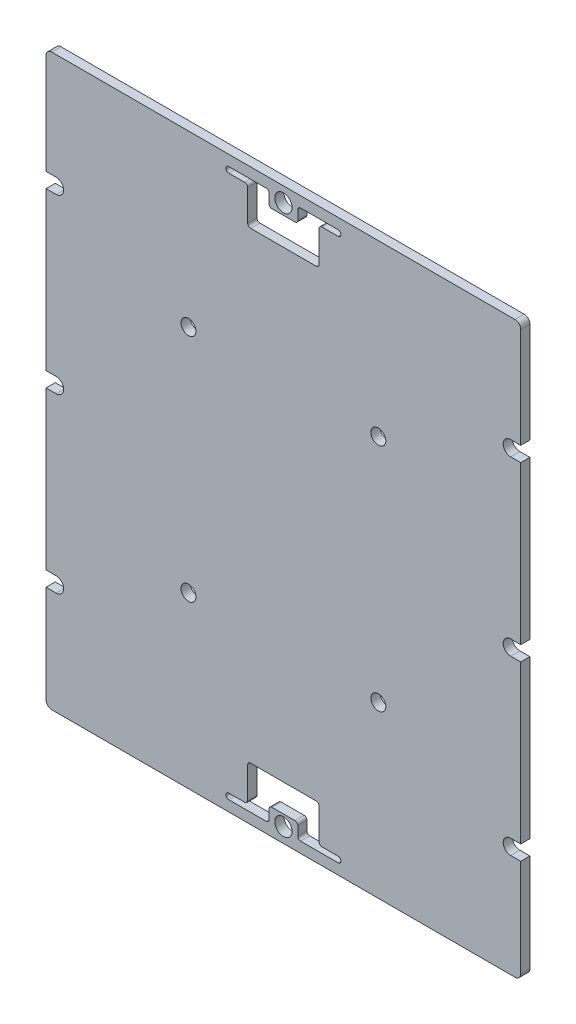
from build123d import *

# Parameters (mm, degrees)
SKETCH2_W            = 82.5
SKETCH2_H            = 99
SKETCH2_R            = 0.8
SKETCH2_R_2          = 1.5
PCB_EXTRUDE_DEPTH    = 0.8
CORNER_FILLETS_R     = 1
SKETCH4_R            = 1.5
SOLAR_HOLES_DEPTH    = 65.454421881
SOLAR_HOLE_FILLETS_R = 0.5
M2_CLEARANCE_HOLES_D = 2.6
SKETCH10_W           = 1.75
SKETCH10_H           = 2.6
CUT_EXTRUDE2_DEPTH   = 65.454421881


with BuildPart() as part:
    # Sketch2 → pcb extrude (new, symmetric)
    with BuildSketch(Plane.XY):
        Rectangle(SKETCH2_W, SKETCH2_H)
        with Locations((-39.5, -30.25)):
            Circle(SKETCH2_R, mode=Mode.SUBTRACT)
        with Locations((-39.5, -0.25)):
            Circle(SKETCH2_R, mode=Mode.SUBTRACT)
        with Locations((-16.5, -20)):
            Circle(SKETCH2_R, mode=Mode.SUBTRACT)
        with Locations((0, -46.95)):
            Circle(SKETCH2_R_2, mode=Mode.SUBTRACT)
        with Locations((39.5, -30.25)):
            Circle(SKETCH2_R, mode=Mode.SUBTRACT)
        with Locations((16.5, -20)):
            Circle(SKETCH2_R, mode=Mode.SUBTRACT)
        with Locations((39.5, -0.25)):
            Circle(SKETCH2_R, mode=Mode.SUBTRACT)
        with Locations((-16.5, 20)):
            Circle(SKETCH2_R, mode=Mode.SUBTRACT)
        with Locations((-39.5, 29.75)):
            Circle(SKETCH2_R, mode=Mode.SUBTRACT)
        with Locations((16.5, 20)):
            Circle(SKETCH2_R, mode=Mode.SUBTRACT)
        with Locations((0, 46.95)):
            Circle(SKETCH2_R, mode=Mode.SUBTRACT)
        with Locations((39.5, 29.75)):
            Circle(SKETCH2_R, mode=Mode.SUBTRACT)
    extrude(amount=PCB_EXTRUDE_DEPTH, both=True)

    # corner fillets
    corner_fillets_edges = [part.edges().sort_by_distance(p)[0] for p in [
        (41.25, -49.5, 0),
        (-41.25, -49.5, 0),
        (41.25, 49.5, 0),
        (-41.25, 49.5, 0),
    ]]
    fillet(corner_fillets_edges, radius=CORNER_FILLETS_R)

    # Sketch4 → solar holes (cut, through all)
    with BuildSketch(Plane.XY.offset(0.8)):
        with Locations((0, 46.95)):
            Circle(SKETCH4_R)
        with Locations((0, -46.95)):
            Circle(SKETCH4_R)
        with BuildLine():
            Line((6.2, 40.25), (-6.2, 40.25))
            Line((-6.2, 40.25), (-6.2, 46.65))
            Line((-6.2, 46.65), (-9.5, 46.65))
            ThreePointArc((-9.5, 46.65), (-10, 47.15), (-9.5, 47.65))
            Line((-9.5, 47.65), (-2.5, 47.65))
            Line((-2.5, 47.65), (-2.5, 45.05))
            Line((-2.5, 45.05), (2.5, 45.05))
            Line((2.5, 45.05), (2.5, 47.65))
            Line((2.5, 47.65), (9.5, 47.65))
            ThreePointArc((9.5, 47.65), (10, 47.15), (9.5, 46.65))
            Line((9.5, 46.65), (6.2, 46.65))
            Line((6.2, 46.65), (6.2, 40.25))
        make_face()
        with BuildLine():
            Line((9.5, -47.65), (2.5, -47.65))
            Line((2.5, -47.65), (2.5, -45.05))
            Line((2.5, -45.05), (-2.5, -45.05))
            Line((-2.5, -45.05), (-2.5, -47.65))
            Line((-2.5, -47.65), (-9.5, -47.65))
            ThreePointArc((-9.5, -47.65), (-10, -47.15), (-9.5, -46.65))
            Line((-9.5, -46.65), (-6.2, -46.65))
            Line((-6.2, -46.65), (-6.2, -40.25))
            Line((-6.2, -40.25), (6.2, -40.25))
            Line((6.2, -40.25), (6.2, -46.65))
            Line((6.2, -46.65), (9.5, -46.65))
            ThreePointArc((9.5, -46.65), (10, -47.15), (9.5, -47.65))
        make_face()
    extrude(amount=-SOLAR_HOLES_DEPTH, mode=Mode.SUBTRACT)

    # solar hole fillets
    solar_hole_fillets_edges = [part.edges().sort_by_distance(p)[0] for p in [
        (-6.2, -46.65, 0),
        (-2.5, -47.65, 0),
        (2.5, -47.65, 0),
        (6.2, -46.65, 0),
        (2.5, -45.05, 0),
        (-2.5, -45.05, 0),
        (6.2, -40.25, 0),
        (-6.2, -40.25, 0),
        (6.2, 46.65, 0),
        (2.5, 47.65, 0),
        (2.5, 45.05, 0),
        (6.2, 40.25, 0),
        (-6.2, 40.25, 0),
        (-6.2, 46.65, 0),
        (-2.5, 45.05, 0),
        (-2.5, 47.65, 0),
    ]]
    fillet(solar_hole_fillets_edges, radius=SOLAR_HOLE_FILLETS_R)

    # M2 Clearance Holes (through all)
    with Locations(Plane.XY.offset(0.8)):
        with Locations((-39.5, 29.75), (-39.5, -0.25), (-16.5, 20), (16.5, 20), (16.5, -20), (-16.5, -20), (39.5, 29.75), (39.5, -0.25), (39.5, -30.25), (-39.5, -30.25)):
            Hole(M2_CLEARANCE_HOLES_D / 2)

    # Sketch10 → Cut-Extrude2 (cut, through all)
    with BuildSketch(Plane.XY.offset(0.8)):
        with Locations((-40.375, 29.75)):
            Rectangle(SKETCH10_W, SKETCH10_H)
        with Locations((-40.375, -0.25)):
            Rectangle(SKETCH10_W, SKETCH10_H)
        with Locations((-40.375, -30.25)):
            Rectangle(SKETCH10_W, SKETCH10_H)
        with Locations((40.375, -30.25)):
            Rectangle(SKETCH10_W, SKETCH10_H)
        with Locations((40.375, -0.25)):
            Rectangle(SKETCH10_W, SKETCH10_H)
        with Locations((40.375, 29.75)):
            Rectangle(SKETCH10_W, SKETCH10_H)
    extrude(amount=-CUT_EXTRUDE2_DEPTH, mode=Mode.SUBTRACT)


solid = part.part
